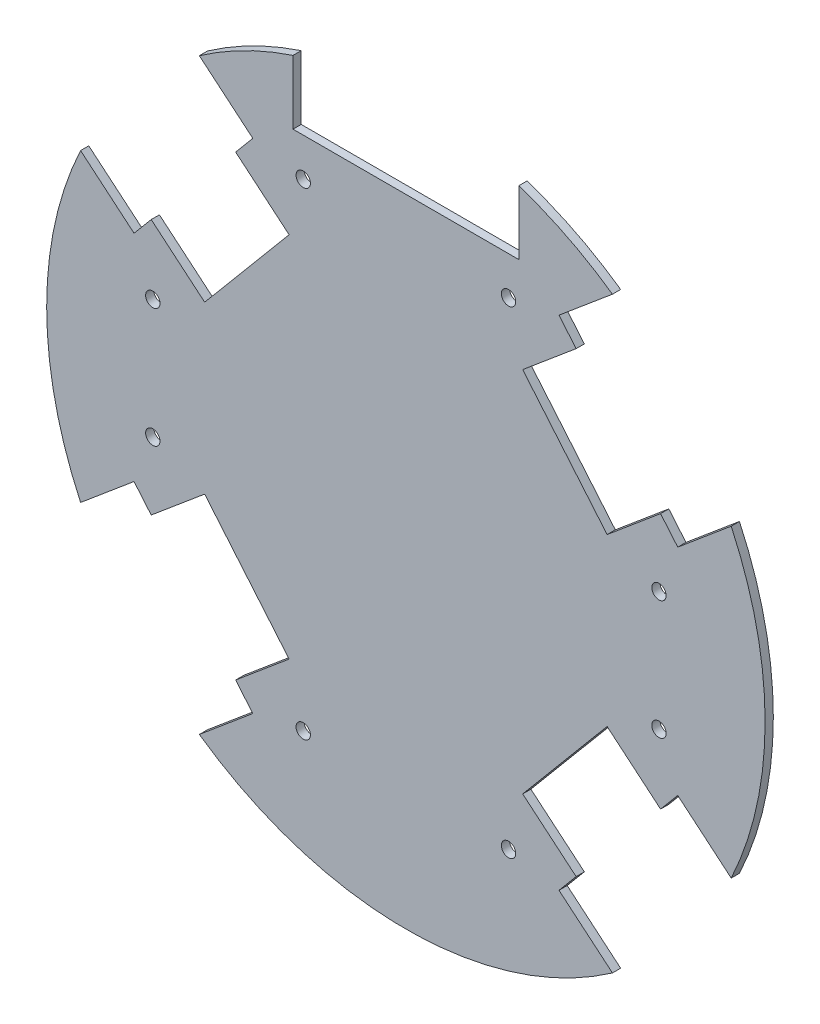
from build123d import *

# Parameters (mm, degrees)
SKETCH1_R                                  = 87.5
BOSS_EXTRUDE1_DEPTH                        = 2
SKETCH3_R                                  = 1.75
CUT_EXTRUDE1_DEPTH                         = 124.759848093
MIRROR1_AT_THE_SECOND_PLANE_COPY_1_SKETC_R = 1.75
MIRROR1_AT_THE_SECOND_PLANE_COPY_1_DEPTH   = 124.759848093
CUT_EXTRUDE2_DEPTH                         = 124.759848093
CUT_EXTRUDE2_DEPTH_BACK                    = 124.759848093
SKETCH4_W                                  = 55
SKETCH4_H                                  = 40


with BuildPart() as part:
    # Sketch1 → Boss-Extrude1 (new body)
    with BuildSketch(Plane.XY):
        Circle(SKETCH1_R)
    extrude(amount=-BOSS_EXTRUDE1_DEPTH)

    # Sketch3 → Cut-Extrude1 (cut, through all)
    with BuildSketch(Plane.XY):
        with BuildLine():
            Line((-62.036781461, 31.168523814), (-49.014025927, 20.241134449))
            Line((-49.014025927, 20.241134449), (-28.444822418, 44.754556629))
            Line((-28.444822418, 44.754556629), (-41.467577951, 55.681945993))
            Line((-41.467577951, 55.681945993), (-37.289458488, 60.661234874))
            Line((-37.289458488, 60.661234874), (-50.312214021, 71.588624238))
            ThreePointArc((-50.312214021, 71.588624238), (-67.028888773, 56.243915848), (-79.237656457, 37.116624298))
            Line((-79.237656457, 37.116624298), (-66.214900923, 26.189234933))
            Line((-66.214900923, 26.189234933), (-62.036781461, 31.168523814))
        make_face()
        with Locations((-61.645137707, 14.522304568)):
            Circle(SKETCH3_R)
        with Locations((-25.006243955, 58.186837826)):
            Circle(SKETCH3_R)
    cut_extrude1 = extrude(amount=-CUT_EXTRUDE1_DEPTH, mode=Mode.SUBTRACT)

    # Mirror1: Cut-Extrude1 across plane
    add(cut_extrude1.mirror(Plane(origin=(0, 0, 0), x_dir=(0, 0, 1), z_dir=(1, 0, 0))), mode=Mode.SUBTRACT)

    # Mirror1 at the second plane: Cut-Extrude1 across plane
    add(cut_extrude1.mirror(Plane.ZX), mode=Mode.SUBTRACT)

    # Mirror1 at the second plane copy 1 sketc → Mirror1 at the second plane copy 1 (cut, through all)
    with BuildSketch(Plane(origin=(0, 0, 0), x_dir=(-1, 0, 0), z_dir=(0, 0, 1))):
        with BuildLine():
            Line((-62.036781461, 31.168523814), (-49.014025927, 20.241134449))
            Line((-49.014025927, 20.241134449), (-28.444822418, 44.754556629))
            Line((-28.444822418, 44.754556629), (-41.467577951, 55.681945993))
            Line((-41.467577951, 55.681945993), (-37.289458488, 60.661234874))
            Line((-37.289458488, 60.661234874), (-50.312214021, 71.588624238))
            ThreePointArc((-50.312214021, 71.588624238), (-67.028888773, 56.243915848), (-79.237656457, 37.116624298))
            Line((-79.237656457, 37.116624298), (-66.214900923, 26.189234933))
            Line((-66.214900923, 26.189234933), (-62.036781461, 31.168523814))
        make_face()
        with Locations((-61.645137707, 14.522304568)):
            Circle(MIRROR1_AT_THE_SECOND_PLANE_COPY_1_SKETC_R)
        with Locations((-25.006243955, 58.186837826)):
            Circle(MIRROR1_AT_THE_SECOND_PLANE_COPY_1_SKETC_R)
    extrude(amount=-MIRROR1_AT_THE_SECOND_PLANE_COPY_1_DEPTH, mode=Mode.SUBTRACT)

    # Sketch4 → Cut-Extrude2 (cut, two sides: drawn at the far end of the back side and taken through both)
    with BuildSketch(Plane.XY.offset(-CUT_EXTRUDE2_DEPTH_BACK)):
        with Locations((0, 87.5)):
            Rectangle(SKETCH4_W, SKETCH4_H)
    extrude(amount=CUT_EXTRUDE2_DEPTH + CUT_EXTRUDE2_DEPTH_BACK, mode=Mode.SUBTRACT)


solid = part.part
